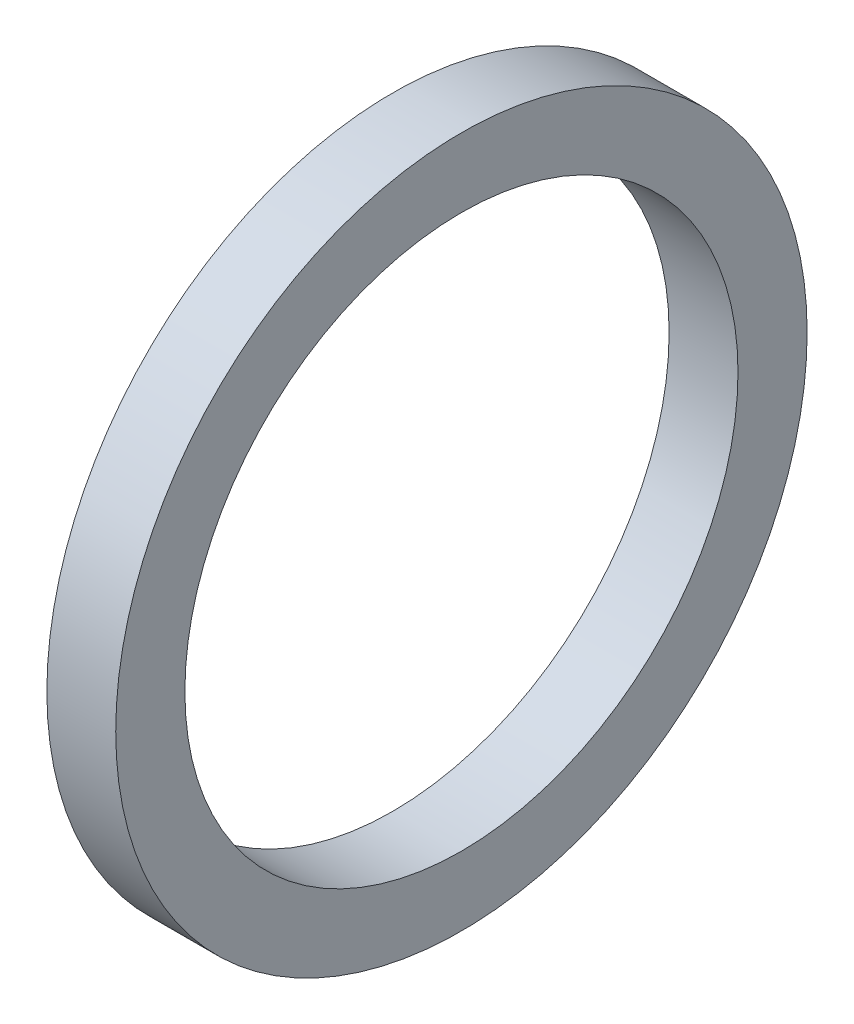
from build123d import *

# Parameters (mm, degrees)
SKETCH3_W = 9.959999892
SKETCH3_H = 9.999999939


with BuildPart() as part:
    # Sketch3 → Revolve1 (revolve)
    with BuildSketch(Plane.XY):
        with Locations((14.599799985, 44.99999998)):
            Rectangle(SKETCH3_W, SKETCH3_H)
    revolve(axis=Axis((0, 0, 0), (1, 0, 0)))


solid = part.part
